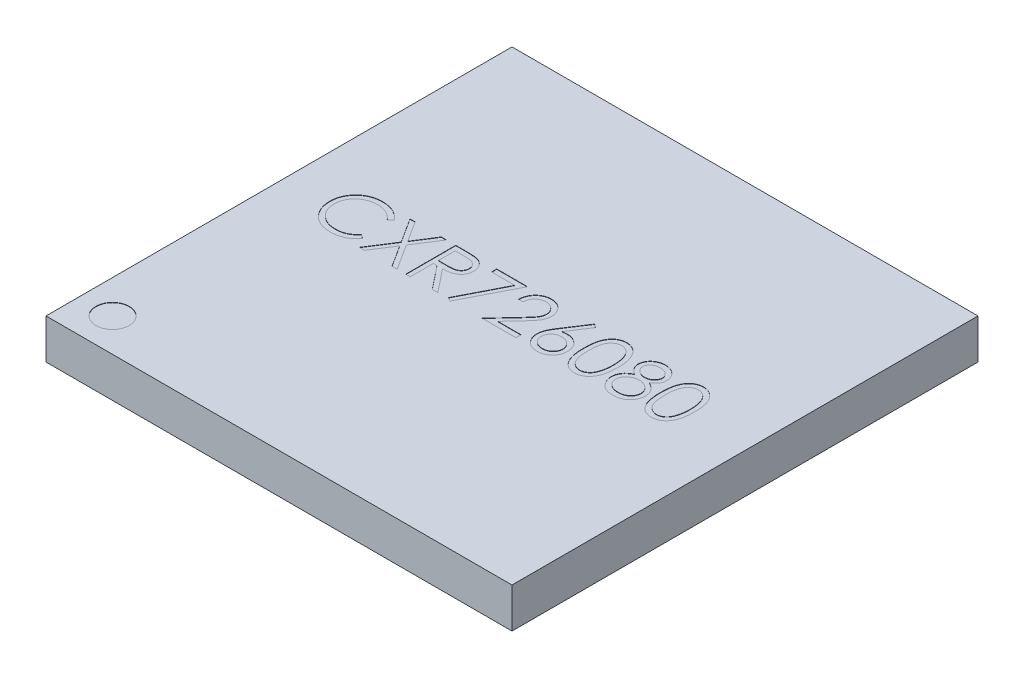
from build123d import *

# Parameters (mm, degrees)
SKIZZE1_W                         = 14
SKIZZE1_H                         = 14
AUFSATZ_LINEAR_AUSTRAGEN1_DEPTH   = 1.2
SKIZZE2_R                         = 0.5
SCHNITT_LINEAR_AUSTRAGEN1_DEPTH   = 0.01
SKIZZE3_R                         = 0.25
AUFSATZ_LINEAR_AUSTRAGEN2_DEPTH   = 0.35
VERRUNDUNG1_R                     = 0.25
LINEARES_MUSTER1_COUNT            = 13
LINEARES_MUSTER1_PITCH            = 1
LINEARES_MUSTER1_COUNT_DIR2       = 13
LINEARES_MUSTER1_PITCH_DIR2       = 1
VERRUNDUNG1_OF_LINEARES_MUSTER1_R = 0.25
SKIZZE4_W                         = 0.885473141
SKIZZE4_H                         = 0.819393056
SKIZZE4_W_2                       = 0.779745005
SKIZZE4_W_3                       = 0.753312971
SKIZZE4_H_2                       = 0.832609073
SKIZZE4_W_4                       = 0.925121192
SKIZZE4_H_3                       = 0.885473142
SCHNITT_LINEAR_AUSTRAGEN2_DEPTH   = 10.971960842


with BuildPart() as part:
    # Skizze1 → Aufsatz-Linear austragen1 (new body)
    with BuildSketch(Plane(origin=(0, 0, 0), x_dir=(1, 0, 0), z_dir=(0, 1, 0))):
        Rectangle(SKIZZE1_W, SKIZZE1_H)
    extrude(amount=AUFSATZ_LINEAR_AUSTRAGEN1_DEPTH)

    # Skizze2 → Schnitt-Linear austragen1 (cut)
    # profile 1 of 10: a face of its own
    with BuildSketch(Plane(origin=(0, 1.2, 0), x_dir=(1, 0, 0), z_dir=(0, 1, 0))):
        with Locations((-6, -6)):
            Circle(SKIZZE2_R)
    # profile 2 of 10: a face of its own
    with BuildSketch(Plane(origin=(0, 1.2, 0), x_dir=(1, 0, 0), z_dir=(0, 1, 0))):
        with BuildLine():
            Line((-4.259270045, 0.717264561), (-4.377058507, 0.627120331))
            add(Edge.make_bspline(
                [(-4.377058507, 0.627120331), (-4.38546103, 0.637134318), (-4.402152793, 0.657027281), (-4.429006737, 0.684961372), (-4.456993155, 0.711132198), (-4.48610135, 0.735664432), (-4.516855259, 0.757700189), (-4.548509887, 0.778387805), (-4.581594763, 0.796931121), (-4.627345506, 0.819415258), (-4.687194584, 0.842877896), (-4.76253523, 0.862550709), (-4.841182843, 0.87507407), (-4.894838957, 0.876430431), (-4.922130622, 0.877120331)],
                knots=[0, 0, 0, 0, 0.757959112, 1.505699292, 2.245454638, 2.979532153, 3.711538275, 4.438200793, 5.171680507, 5.909471876, 7.393775596, 8.890124382, 10.418191784, 12, 12, 12, 12], degree=3))
            add(Edge.make_bspline(
                [(-4.922130622, 0.877120331), (-4.937166322, 0.876947204), (-4.967098176, 0.876602557), (-5.01151895, 0.872055789), (-5.055110258, 0.86566527), (-5.097843743, 0.856182989), (-5.139665011, 0.844194724), (-5.180847469, 0.829869546), (-5.220794869, 0.812146044), (-5.260059828, 0.792556789), (-5.29767949, 0.770430742), (-5.333274511, 0.746296448), (-5.366715068, 0.720423978), (-5.398027616, 0.692716361), (-5.427244166, 0.663298378), (-5.454153013, 0.631856517), (-5.478661046, 0.5984913), (-5.501254057, 0.563642697), (-5.521488085, 0.527412215), (-5.538429462, 0.489665756), (-5.553431657, 0.451049712), (-5.565302761, 0.411127786), (-5.574698983, 0.370180886), (-5.581182267, 0.32809912), (-5.585677326, 0.2849704), (-5.586020259, 0.255737837), (-5.586193122, 0.241002542)],
                knots=[0, 0, 0, 0, 1.054917814, 2.100044995, 3.131103042, 4.146048494, 5.169673617, 6.183595914, 7.203665975, 8.234915748, 9.262203917, 10.264457458, 11.251630812, 12.227803204, 13.197192746, 14.159520551, 15.12972552, 16.100847026, 17.073214652, 18.039054194, 19.002613845, 19.979014051, 20.95965708, 21.949030935, 22.966165397, 24, 24, 24, 24], degree=3))
            add(Edge.make_bspline(
                [(-5.586193122, 0.241002542), (-5.585652342, 0.218831976), (-5.584590593, 0.175303011), (-5.575141307, 0.111544178), (-5.560781982, 0.05046389), (-5.539261021, -0.007556043), (-5.512724285, -0.063231053), (-5.479192594, -0.115619133), (-5.440356935, -0.165511947), (-5.395667899, -0.211730353), (-5.346636835, -0.253950521), (-5.294030587, -0.291129342), (-5.237980178, -0.322121434), (-5.179104479, -0.347911125), (-5.11695043, -0.367735437), (-5.051629801, -0.38169149), (-4.98328466, -0.390795282), (-4.936583488, -0.391666863), (-4.912815718, -0.392110439)],
                knots=[0, 0, 0, 0, 1.029171465, 2.020641659, 2.987623507, 3.938342917, 4.889210282, 5.84687017, 6.821220943, 7.821438502, 8.827599549, 9.822697543, 10.807740252, 11.797342354, 12.80366471, 13.83203677, 14.896651826, 16, 16, 16, 16], degree=3))
            add(Edge.make_bspline(
                [(-4.912815718, -0.392110439), (-4.886628851, -0.391386676), (-4.835086833, -0.389962138), (-4.759500536, -0.377893888), (-4.687142351, -0.358326209), (-4.618008385, -0.330941385), (-4.552293537, -0.295341976), (-4.489894968, -0.252185743), (-4.430760009, -0.201062172), (-4.395200888, -0.162026545), (-4.377058507, -0.142110439)],
                knots=[0, 0, 0, 0, 1.028121516, 2.023589091, 2.998037872, 3.967518031, 4.937445131, 5.927275754, 6.942489185, 8, 8, 8, 8], degree=3))
            Line((-4.377058507, -0.142110439), (-4.259270045, -0.231353227))
            add(Edge.make_bspline(
                [(-4.259270045, -0.231353227), (-4.268749235, -0.243583992), (-4.28766221, -0.267986938), (-4.318287074, -0.302389099), (-4.350548773, -0.334747971), (-4.384686935, -0.364802666), (-4.420308845, -0.39315458), (-4.458054122, -0.418998222), (-4.497426565, -0.442694315), (-4.53829277, -0.464391569), (-4.580609318, -0.483641817), (-4.624325505, -0.500122004), (-4.669252894, -0.514318385), (-4.715393541, -0.525997786), (-4.762843151, -0.535113965), (-4.811430497, -0.541208111), (-4.861260443, -0.545383218), (-4.894878195, -0.545763753), (-4.911914276, -0.545956593)],
                knots=[0, 0, 0, 0, 0.986787822, 1.968848986, 2.935600012, 3.899624008, 4.868462664, 5.837806735, 6.815139263, 7.798259679, 8.787526145, 9.778297419, 10.776456485, 11.791383307, 12.812564526, 13.85620153, 14.913611965, 16, 16, 16, 16], degree=3))
            add(Edge.make_bspline(
                [(-4.911914276, -0.545956593), (-4.928047276, -0.54584431), (-4.959948286, -0.545622285), (-5.007047751, -0.542025642), (-5.052900428, -0.537118612), (-5.097375268, -0.529729984), (-5.140714972, -0.521010981), (-5.182526651, -0.5093233), (-5.223221741, -0.4962308), (-5.262636744, -0.480842949), (-5.300805187, -0.46347887), (-5.337603963, -0.443853917), (-5.373016148, -0.422133117), (-5.4073899, -0.398795256), (-5.440217436, -0.373090698), (-5.471783233, -0.345376426), (-5.502264294, -0.31574585), (-5.521122587, -0.294379484), (-5.53060418, -0.283636881)],
                knots=[0, 0, 0, 0, 1.114604814, 2.203992996, 3.262667896, 4.300477797, 5.318619304, 6.316056647, 7.298880507, 8.271930387, 9.238335007, 10.195173496, 11.151986948, 12.108099108, 13.064862484, 14.031167946, 15.010108607, 16, 16, 16, 16], degree=3))
            add(Edge.make_bspline(
                [(-5.53060418, -0.283636881), (-5.545790884, -0.264976371), (-5.575980945, -0.227880638), (-5.614606238, -0.167758075), (-5.647669476, -0.104985986), (-5.674402014, -0.039234587), (-5.695300328, 0.029348578), (-5.709777983, 0.100798085), (-5.719185814, 0.175047203), (-5.720261652, 0.225548684), (-5.720808507, 0.251218888)],
                knots=[0, 0, 0, 0, 0.994628077, 1.977248131, 2.950237994, 3.925870899, 4.908910175, 5.911660606, 6.938484602, 8, 8, 8, 8], degree=3))
            add(Edge.make_bspline(
                [(-5.720808507, 0.251218888), (-5.720141995, 0.278199797), (-5.718830675, 0.33128305), (-5.70768962, 0.409186173), (-5.689767279, 0.483822487), (-5.664311469, 0.555052663), (-5.632037747, 0.623251355), (-5.592169199, 0.687897585), (-5.545168995, 0.749404785), (-5.491405751, 0.806839679), (-5.432448322, 0.859356544), (-5.369311688, 0.905559203), (-5.302119425, 0.944009567), (-5.231611774, 0.976150779), (-5.157260767, 1.000855549), (-5.079225038, 1.018149772), (-4.997651217, 1.02891425), (-4.941995892, 1.030275054), (-4.91371716, 1.030966484)],
                knots=[0, 0, 0, 0, 1.032925535, 2.032216505, 3.007276963, 3.968222605, 4.92396291, 5.891752235, 6.871517503, 7.883894988, 8.900124299, 9.891468569, 10.874487609, 11.85992873, 12.854644235, 13.869047385, 14.917252991, 16, 16, 16, 16], degree=3))
            add(Edge.make_bspline(
                [(-4.91371716, 1.030966484), (-4.896482387, 1.030759854), (-4.862367888, 1.030350849), (-4.811902465, 1.026362503), (-4.76277004, 1.019713814), (-4.714936762, 1.01066407), (-4.668169926, 0.999432361), (-4.622826966, 0.984800804), (-4.578641814, 0.968070862), (-4.535893139, 0.948802948), (-4.494786046, 0.927174345), (-4.455333338, 0.903424792), (-4.417848399, 0.877583732), (-4.382067464, 0.849870943), (-4.348589088, 0.819700132), (-4.31646274, 0.787901162), (-4.286779421, 0.753558095), (-4.268456623, 0.729384552), (-4.259270045, 0.717264561)],
                knots=[0, 0, 0, 0, 1.096760587, 2.17092713, 3.219439832, 4.250915756, 5.268269357, 6.278326846, 7.281116186, 8.274029601, 9.260640565, 10.235837813, 11.203064059, 12.156899882, 13.114053108, 14.069676657, 15.032185724, 16, 16, 16, 16], degree=3))
        make_face()
    # profile 3 of 10: a face of its own
    with BuildSketch(Plane(origin=(0, 1.2, 0), x_dir=(1, 0, 0), z_dir=(0, 1, 0))):
        Polygon((-4.057346968, 0.992504946), (-3.90199841, 0.992504946), (-3.509270045, 0.378923215), (-3.11654168, 0.992504946), (-2.961193122, 0.992504946), (-3.431445526, 0.257528984), (-2.941962353, -0.507495054), (-3.09731091, -0.507495054), (-3.509270045, 0.136134754), (-3.92122918, -0.507495054), (-4.076577737, -0.507495054), (-3.586794083, 0.257528984), align=None)
    # profile 4 of 10: a face of its own
    with BuildSketch(Plane(origin=(0, 1.2, 0), x_dir=(1, 0, 0), z_dir=(0, 1, 0))):
        with BuildLine():
            Line((-2.682346968, 0.992504946), (-2.38216668, 0.992504946))
            add(Edge.make_bspline(
                [(-2.38216668, 0.992504946), (-2.362134767, 0.992438266), (-2.323671277, 0.992310234), (-2.268568447, 0.991596335), (-2.218499691, 0.989550183), (-2.173491188, 0.987789361), (-2.133543765, 0.984578529), (-2.098534926, 0.981509681), (-2.068625913, 0.977492398), (-2.050520548, 0.973761502), (-2.04232293, 0.972072254)],
                knots=[0, 0, 0, 0, 1.410062039, 2.707475311, 3.878576406, 4.937260626, 5.877586885, 6.699081471, 7.410979367, 8, 8, 8, 8], degree=3))
            add(Edge.make_bspline(
                [(-2.04232293, 0.972072254), (-2.031348662, 0.969360783), (-2.009634238, 0.963995684), (-1.978369924, 0.952655855), (-1.948578071, 0.939533159), (-1.920382432, 0.924120136), (-1.893924236, 0.906302373), (-1.868930674, 0.886387464), (-1.845288332, 0.864484375), (-1.823953348, 0.840040872), (-1.803836612, 0.814396653), (-1.786870057, 0.786666472), (-1.772244423, 0.757668674), (-1.760599916, 0.727108352), (-1.751223642, 0.695281879), (-1.744612396, 0.661900966), (-1.740647602, 0.627117691), (-1.740243949, 0.603392873), (-1.740039276, 0.591363119)],
                knots=[0, 0, 0, 0, 1.027469482, 2.033020251, 3.019912614, 3.986113645, 4.951240523, 5.91722682, 6.890402269, 7.87763091, 8.8651537, 9.85103654, 10.82876324, 11.815024772, 12.821070561, 13.842952187, 14.906261191, 16, 16, 16, 16], degree=3))
            add(Edge.make_bspline(
                [(-1.740039276, 0.591363119), (-1.740668846, 0.571376646), (-1.741897302, 0.532377859), (-1.753350918, 0.475780339), (-1.772112283, 0.422984918), (-1.797965121, 0.374058073), (-1.830887754, 0.329953511), (-1.870455521, 0.291214745), (-1.916690498, 0.258797639), (-1.959731633, 0.236317866), (-1.997752004, 0.221920905), (-2.029051996, 0.211791037), (-2.063194986, 0.20396448), (-2.099853844, 0.196952995), (-2.139181125, 0.191659412), (-2.18108257, 0.1877823), (-2.225588064, 0.185359136), (-2.25616195, 0.184998277), (-2.271890237, 0.184812638)],
                knots=[0, 0, 0, 0, 1.260483769, 2.459530307, 3.627416485, 4.787058657, 5.939039949, 7.08810263, 8.267026773, 9.491475466, 10.141966685, 10.831826277, 11.566392101, 12.351337768, 13.187381173, 14.07005841, 15.007169909, 16, 16, 16, 16], degree=3))
            Line((-2.271890237, 0.184812638), (-1.720808507, -0.507495054))
            Line((-1.720808507, -0.507495054), (-1.887274853, -0.507495054))
            Line((-1.887274853, -0.507495054), (-2.438356583, 0.184812638))
            Line((-2.438356583, 0.184812638), (-2.547731583, 0.184812638))
            Line((-2.547731583, 0.184812638), (-2.547731583, -0.507495054))
            Line((-2.547731583, -0.507495054), (-2.682346968, -0.507495054))
            Line((-2.682346968, -0.507495054), (-2.682346968, 0.992504946))
        make_face()
        with BuildLine():
            Line((-2.547731583, 0.838658792), (-2.547731583, 0.338658792))
            Line((-2.547731583, 0.338658792), (-2.27309216, 0.336555427))
            add(Edge.make_bspline(
                [(-2.27309216, 0.336555427), (-2.260269287, 0.336549754), (-2.235414905, 0.336538758), (-2.199457477, 0.338250377), (-2.165977429, 0.340197513), (-2.135102821, 0.343175804), (-2.10681986, 0.34701412), (-2.081142683, 0.351815399), (-2.058029375, 0.357409141), (-2.031072859, 0.36606698), (-2.000971488, 0.379783845), (-1.968258005, 0.399740487), (-1.940399861, 0.424841538), (-1.916863634, 0.453544448), (-1.897951021, 0.485102841), (-1.884617283, 0.519138427), (-1.876156236, 0.554791969), (-1.875158288, 0.579296873), (-1.87465466, 0.5916636)],
                knots=[0, 0, 0, 0, 1.146690395, 2.22261258, 3.21895312, 4.145990853, 4.996080663, 5.770904154, 6.481378293, 7.121626537, 8.300444488, 9.431385265, 10.535395872, 11.636531494, 12.74115979, 13.810798291, 14.895190096, 16, 16, 16, 16], degree=3))
            add(Edge.make_bspline(
                [(-1.87465466, 0.5916636), (-1.875169855, 0.603726417), (-1.876190783, 0.627630519), (-1.88452597, 0.662625909), (-1.898621419, 0.695654602), (-1.917616664, 0.726582239), (-1.940759159, 0.754656126), (-1.967895364, 0.778676334), (-1.998283305, 0.798497533), (-2.026685247, 0.811163696), (-2.052071338, 0.818929348), (-2.074112621, 0.824394132), (-2.09901754, 0.828784619), (-2.126907022, 0.832302359), (-2.157662007, 0.835325907), (-2.191438, 0.837362383), (-2.228010906, 0.838568325), (-2.253359591, 0.838627935), (-2.266481583, 0.838658792)],
                knots=[0, 0, 0, 0, 1.101028733, 2.181837193, 3.264309656, 4.369019818, 5.486613113, 6.575447106, 7.666700264, 8.788928104, 9.402425223, 10.0903467, 10.862060571, 11.710948788, 12.657782767, 13.684531032, 14.801375019, 16, 16, 16, 16], degree=3))
            Line((-2.266481583, 0.838658792), (-2.547731583, 0.838658792))
        make_face(mode=Mode.SUBTRACT)
    # profile 5 of 10: a face of its own
    with BuildSketch(Plane(origin=(0, 1.2, 0), x_dir=(1, 0, 0), z_dir=(0, 1, 0))):
        Polygon((-1.451577737, 0.992504946), (-0.528500814, 0.992504946), (-1.316962353, -0.545956593), (-1.43324841, -0.481954189), (-0.756265237, 0.838658792), (-1.451577737, 0.838658792), align=None)
    # profile 6 of 10: a face of its own
    with BuildSketch(Plane(origin=(0, 1.2, 0), x_dir=(1, 0, 0), z_dir=(0, 1, 0))):
        with BuildLine():
            Line((-0.201577737, 0.530966484), (-0.336193122, 0.530966484))
            add(Edge.make_bspline(
                [(-0.336193122, 0.530966484), (-0.335315771, 0.548825436), (-0.333592676, 0.583899943), (-0.325523409, 0.63503876), (-0.313977319, 0.683919388), (-0.29765241, 0.730149351), (-0.277378291, 0.774137411), (-0.253065422, 0.815708846), (-0.224268058, 0.85470507), (-0.191608029, 0.890764574), (-0.156135755, 0.923844962), (-0.117861781, 0.952411494), (-0.077642483, 0.976547639), (-0.035599884, 0.996725314), (0.008740358, 1.011870963), (0.054975868, 1.023108808), (0.103309784, 1.029870099), (0.136241222, 1.030596864), (0.15298957, 1.030966484)],
                knots=[0, 0, 0, 0, 1.10065271, 2.161652631, 3.183658789, 4.190468796, 5.17591951, 6.163126047, 7.15150782, 8.156236427, 9.156009102, 10.134482811, 11.092018607, 12.041330605, 13.001268258, 13.972401359, 14.968799086, 16, 16, 16, 16], degree=3))
            add(Edge.make_bspline(
                [(0.15298957, 1.030966484), (0.169437316, 1.030581432), (0.20175655, 1.029824817), (0.248925985, 1.023327233), (0.293830539, 1.013150551), (0.336382439, 0.998872515), (0.376242181, 0.979679189), (0.4137092, 0.956623101), (0.449229548, 0.929957459), (0.481203884, 0.898562968), (0.510564489, 0.86504766), (0.535894027, 0.82926713), (0.557585383, 0.792311722), (0.575665817, 0.753899635), (0.588975591, 0.713669194), (0.599080537, 0.672206108), (0.604792286, 0.629081189), (0.605668896, 0.599892665), (0.60611457, 0.585053023)],
                knots=[0, 0, 0, 0, 1.111607364, 2.184268762, 3.212621178, 4.221274766, 5.211760367, 6.196651075, 7.1921475, 8.207485113, 9.220403448, 10.201281604, 11.166441695, 12.114753415, 13.065576456, 14.026450734, 14.996634279, 16, 16, 16, 16], degree=3))
            add(Edge.make_bspline(
                [(0.60611457, 0.585053023), (0.605388886, 0.564161094), (0.603950253, 0.522743859), (0.591644092, 0.461880347), (0.572424158, 0.402911739), (0.549282434, 0.355452895), (0.525937101, 0.317209969), (0.504899597, 0.285723381), (0.480271821, 0.251821037), (0.451695322, 0.215616464), (0.419761234, 0.176826076), (0.384180307, 0.135473307), (0.344698815, 0.091985406), (0.316988029, 0.062283005), (0.302628993, 0.046891965)],
                knots=[0, 0, 0, 0, 1.184426356, 2.348067706, 3.509069118, 4.696110526, 5.333549288, 6.050745305, 6.844228056, 7.710549037, 8.667450064, 9.695053472, 10.805634456, 12, 12, 12, 12], degree=3))
            Line((0.302628993, 0.046891965), (-0.072671487, -0.3536489))
            Line((-0.072671487, -0.3536489), (0.62534534, -0.3536489))
            Line((0.62534534, -0.3536489), (0.62534534, -0.507495054))
            Line((0.62534534, -0.507495054), (-0.39388543, -0.507495054))
            Line((-0.39388543, -0.507495054), (0.18784534, 0.113298215))
            add(Edge.make_bspline(
                [(0.18784534, 0.113298215), (0.20200872, 0.128083204), (0.229213674, 0.156482141), (0.267691921, 0.197943409), (0.302251488, 0.236407498), (0.333116085, 0.271801733), (0.359616158, 0.304643834), (0.383132829, 0.333870135), (0.401975225, 0.3607649), (0.422424681, 0.391939449), (0.442230673, 0.43000187), (0.459250254, 0.476516309), (0.469628046, 0.524399417), (0.470872976, 0.556757433), (0.471499186, 0.573033792)],
                knots=[0, 0, 0, 0, 1.329631726, 2.553950428, 3.673215718, 4.687767853, 5.603093632, 6.413772471, 7.123043292, 7.734684054, 8.834405432, 9.900288307, 10.943827018, 12, 12, 12, 12], degree=3))
            add(Edge.make_bspline(
                [(0.471499186, 0.573033792), (0.471226725, 0.583268677), (0.470689757, 0.60343967), (0.465950743, 0.633013567), (0.458789098, 0.661541344), (0.448526844, 0.689110752), (0.434981099, 0.715444603), (0.418492507, 0.740574952), (0.399468194, 0.764870223), (0.377460507, 0.787650208), (0.353284142, 0.808513581), (0.327743749, 0.826995332), (0.300722276, 0.842440665), (0.272333652, 0.855102164), (0.242657022, 0.865034471), (0.211634989, 0.871916719), (0.179353268, 0.876237783), (0.157310341, 0.876822428), (0.146078513, 0.877120331)],
                knots=[0, 0, 0, 0, 0.991446411, 1.95395049, 2.89581595, 3.838931463, 4.798493298, 5.75982156, 6.748411868, 7.785213223, 8.824556874, 9.840280684, 10.836137867, 11.835679398, 12.848801643, 13.863922112, 14.911575587, 16, 16, 16, 16], degree=3))
            add(Edge.make_bspline(
                [(0.146078513, 0.877120331), (0.134348156, 0.876813888), (0.111311672, 0.876212086), (0.077489229, 0.872002373), (0.045223896, 0.86473987), (0.014434509, 0.854807009), (-0.014931028, 0.842181917), (-0.042729904, 0.826456883), (-0.068899714, 0.807692529), (-0.093489652, 0.786418005), (-0.116145643, 0.76273189), (-0.136051447, 0.73632762), (-0.153444596, 0.7076873), (-0.168619982, 0.676888206), (-0.180943849, 0.643650872), (-0.190360914, 0.608093284), (-0.197812419, 0.570369835), (-0.200301785, 0.544319085), (-0.201577737, 0.530966484)],
                knots=[0, 0, 0, 0, 1.031018746, 2.02475058, 2.990194455, 3.934040569, 4.864654155, 5.795059489, 6.735614925, 7.690564532, 8.649604399, 9.611025574, 10.590972636, 11.591080095, 12.624614302, 13.701020113, 14.821632451, 16, 16, 16, 16], degree=3))
        make_face()
    # profile 7 of 10: a face of its own
    with BuildSketch(Plane(origin=(0, 1.2, 0), x_dir=(1, 0, 0), z_dir=(0, 1, 0))):
        with BuildLine():
            Line((1.452268417, 1.030966484), (1.555934282, 0.949536196))
            Line((1.555934282, 0.949536196), (1.159600147, 0.343466484))
            add(Edge.make_bspline(
                [(1.159600147, 0.343466484), (1.185987409, 0.347672425), (1.237458746, 0.355876587), (1.289558417, 0.357229992), (1.314948705, 0.357889561)],
                knots=[0, 0, 0, 0, 1.025318673, 2, 2, 2, 2], degree=3))
            add(Edge.make_bspline(
                [(1.314948705, 0.357889561), (1.330194061, 0.357479799), (1.360204089, 0.356673195), (1.404264147, 0.35046583), (1.446602263, 0.340683639), (1.487042954, 0.326424101), (1.525731375, 0.308208806), (1.562889544, 0.286377862), (1.597818977, 0.259803999), (1.630969483, 0.230119018), (1.66106681, 0.19724031), (1.687713691, 0.162354023), (1.710096602, 0.125496502), (1.728256854, 0.086686417), (1.742358945, 0.045983592), (1.752639364, 0.003440103), (1.758716332, -0.040973385), (1.759541543, -0.071178317), (1.759960724, -0.086521496)],
                knots=[0, 0, 0, 0, 1.04369286, 2.054478336, 3.041073146, 4.015093852, 4.984733326, 5.965804835, 6.960378782, 7.985147595, 9.009457201, 10.008161701, 10.986880575, 11.956520048, 12.937015923, 13.931873656, 14.949455224, 16, 16, 16, 16], degree=3))
            add(Edge.make_bspline(
                [(1.759960724, -0.086521496), (1.759350822, -0.107512798), (1.758150679, -0.148818712), (1.746191909, -0.208980158), (1.727609205, -0.266294093), (1.701047407, -0.319845452), (1.668054957, -0.369560839), (1.627821703, -0.413611753), (1.581774494, -0.452898912), (1.529708723, -0.485751748), (1.473676024, -0.512581627), (1.414810882, -0.531852445), (1.353684962, -0.543716789), (1.312197273, -0.545204191), (1.291210724, -0.545956593)],
                knots=[0, 0, 0, 0, 1.031375318, 2.029502543, 3.004789286, 3.987476834, 4.960371455, 5.9300674, 6.912260825, 7.929083631, 8.949397511, 9.960523116, 10.96833055, 12, 12, 12, 12], degree=3))
            add(Edge.make_bspline(
                [(1.291210724, -0.545956593), (1.271026424, -0.545301647), (1.231044859, -0.544004315), (1.172230804, -0.532447485), (1.115718083, -0.513715869), (1.061902634, -0.48790975), (1.012050943, -0.455313514), (0.967451384, -0.416072538), (0.928326338, -0.371025624), (0.895765786, -0.320179761), (0.869940615, -0.265541208), (0.850573504, -0.208568141), (0.839260829, -0.149468148), (0.837680019, -0.109404803), (0.836883801, -0.089225823)],
                knots=[0, 0, 0, 0, 1.012016664, 2.004627821, 2.994792927, 3.992885782, 4.990978636, 5.973936114, 6.964471063, 7.975201453, 8.993600317, 9.990122807, 10.98767138, 12, 12, 12, 12], degree=3))
            add(Edge.make_bspline(
                [(0.836883801, -0.089225823), (0.837390135, -0.073778145), (0.838423971, -0.042236937), (0.845642567, 0.005533361), (0.857241765, 0.054412396), (0.87023187, 0.095878479), (0.883957132, 0.129847703), (0.895379649, 0.157234913), (0.909597076, 0.18541823), (0.924757096, 0.215364074), (0.942224326, 0.246300688), (0.961216747, 0.278745118), (0.982259454, 0.312181372), (0.997010953, 0.334871742), (1.00455207, 0.346471292)],
                knots=[0, 0, 0, 0, 1.173818275, 2.396712641, 3.66331629, 4.989737886, 5.693666774, 6.447286557, 7.243889047, 8.091586357, 8.998013824, 9.943181721, 10.948533338, 12, 12, 12, 12], degree=3))
            Line((1.00455207, 0.346471292), (1.452268417, 1.030966484))
        make_face()
        with BuildLine():
            add(Edge.make_bspline(
                [(1.286703513, 0.204043407), (1.275276836, 0.20370996), (1.252957218, 0.203058641), (1.220211183, 0.19927639), (1.18921979, 0.192153933), (1.159572447, 0.183082648), (1.131823431, 0.170609908), (1.105771071, 0.155459137), (1.08131462, 0.137621489), (1.058710241, 0.11734967), (1.0382161, 0.095154799), (1.020567044, 0.071382147), (1.005343158, 0.046604631), (0.992965235, 0.020615227), (0.983326632, -0.00657613), (0.976354524, -0.034844379), (0.972474345, -0.064379082), (0.971828817, -0.084407297), (0.971499186, -0.094634477)],
                knots=[0, 0, 0, 0, 1.129588631, 2.206414736, 3.251139165, 4.268635594, 5.265702196, 6.250456724, 7.242448911, 8.251968645, 9.246821453, 10.222880186, 11.173611482, 12.116736599, 13.062300278, 14.020270554, 14.989073742, 16, 16, 16, 16], degree=3))
            add(Edge.make_bspline(
                [(0.971499186, -0.094634477), (0.971767626, -0.104770183), (0.972293999, -0.124644793), (0.977073564, -0.153933013), (0.984374314, -0.182117973), (0.995234483, -0.209054373), (1.008188864, -0.235152795), (1.025291146, -0.259467917), (1.044241197, -0.283476519), (1.066892883, -0.305334292), (1.091202895, -0.325672845), (1.117174839, -0.343450097), (1.144243394, -0.358658457), (1.172774003, -0.370577499), (1.202361882, -0.380359336), (1.233253548, -0.387242827), (1.265470486, -0.391134481), (1.287294174, -0.39178085), (1.298422263, -0.392110439)],
                knots=[0, 0, 0, 0, 0.989467248, 1.94019797, 2.891935182, 3.827694429, 4.772920941, 5.730924762, 6.725747692, 7.756678648, 8.79901574, 9.819492441, 10.826891316, 11.826466727, 12.835195252, 13.867842842, 14.912794438, 16, 16, 16, 16], degree=3))
            add(Edge.make_bspline(
                [(1.298422263, -0.392110439), (1.309550334, -0.391780824), (1.331373985, -0.391134404), (1.363591183, -0.387243118), (1.394481891, -0.380358269), (1.424073252, -0.370581367), (1.452591008, -0.358644106), (1.479635888, -0.343544712), (1.505362214, -0.325563518), (1.529688185, -0.305369049), (1.552245588, -0.283352113), (1.571650136, -0.259682232), (1.588228664, -0.234956276), (1.601700459, -0.209157181), (1.612441012, -0.182101686), (1.619778784, -0.153937376), (1.624548479, -0.12464365), (1.625076207, -0.104769797), (1.62534534, -0.094634477)],
                knots=[0, 0, 0, 0, 1.087397944, 2.132534446, 3.165364764, 4.174271784, 5.174024072, 6.181601208, 7.194203697, 8.236725232, 9.267838612, 10.269026844, 11.221737037, 12.171628256, 13.107553087, 14.05945871, 15.010357665, 16, 16, 16, 16], degree=3))
            add(Edge.make_bspline(
                [(1.62534534, -0.094634477), (1.6251095, -0.084393955), (1.624646623, -0.064295141), (1.619411216, -0.034857591), (1.612150199, -0.006432502), (1.601186043, 0.020801476), (1.586941809, 0.046736873), (1.569591778, 0.071504702), (1.549520676, 0.095294851), (1.526336016, 0.117393197), (1.501097345, 0.137599088), (1.474262094, 0.155436041), (1.446187248, 0.170489602), (1.416901273, 0.183049789), (1.386068609, 0.192113849), (1.354187035, 0.199250953), (1.320848788, 0.203048961), (1.298230242, 0.203707703), (1.286703513, 0.204043407)],
                knots=[0, 0, 0, 0, 0.978206639, 1.919901502, 2.851605144, 3.780102724, 4.718870031, 5.675451981, 6.667674623, 7.690630536, 8.733308323, 9.756129687, 10.767539656, 11.776269907, 12.797430371, 13.836405707, 14.897401972, 16, 16, 16, 16], degree=3))
        make_face(mode=Mode.SUBTRACT)
    # profile 8 of 10: a face of its own
    with BuildSketch(Plane(origin=(0, 1.2, 0), x_dir=(1, 0, 0), z_dir=(0, 1, 0))):
        with BuildLine():
            add(Edge.make_bspline(
                [(1.913806878, 0.241903984), (1.913947457, 0.265945722), (1.914220534, 0.312647144), (1.917258429, 0.380697705), (1.922305004, 0.444537829), (1.929221021, 0.504170571), (1.937637299, 0.559611327), (1.948872507, 0.610711938), (1.961649423, 0.657708912), (1.976457614, 0.700755504), (1.993166666, 0.740431662), (2.011352778, 0.777471034), (2.03173769, 0.811817577), (2.053156367, 0.844019487), (2.076475826, 0.873549642), (2.10103245, 0.900825069), (2.127784683, 0.92521539), (2.155823115, 0.947435234), (2.1854016, 0.966913579), (2.215677028, 0.984070467), (2.246857788, 0.998727553), (2.279029009, 1.010252026), (2.311901534, 1.01977096), (2.345590277, 1.026280509), (2.380150861, 1.030376327), (2.403478619, 1.030767899), (2.415309282, 1.030966484)],
                knots=[0, 0, 0, 0, 1.646270934, 3.197905019, 4.663502075, 6.030701355, 7.308322542, 8.50163776, 9.611534131, 10.641858119, 11.616356847, 12.558055219, 13.465016945, 14.349605745, 15.204443733, 16.039544428, 16.859896111, 17.680448484, 18.487036065, 19.28249412, 20.06191084, 20.843045899, 21.620316918, 22.403196591, 23.190181807, 24, 24, 24, 24], degree=3))
            add(Edge.make_bspline(
                [(2.415309282, 1.030966484), (2.427238773, 1.030757421), (2.450962777, 1.030341659), (2.486037223, 1.026345684), (2.520301372, 1.019715202), (2.553609146, 1.010320499), (2.58623414, 0.998665209), (2.617921172, 0.984056444), (2.648867064, 0.967051215), (2.678580045, 0.947069554), (2.707386308, 0.924791435), (2.734578293, 0.899607435), (2.760158472, 0.871771841), (2.784447889, 0.84158247), (2.80675743, 0.808460291), (2.828003187, 0.772981387), (2.847019774, 0.734525302), (2.865334635, 0.693733673), (2.881143343, 0.649477819), (2.895400306, 0.602007207), (2.906919864, 0.550761127), (2.916515266, 0.496008451), (2.923948793, 0.437548101), (2.929362782, 0.375505394), (2.932222676, 0.309839513), (2.932761262, 0.264943291), (2.933037647, 0.241903984)],
                knots=[0, 0, 0, 0, 0.810914788, 1.612654377, 2.396697861, 3.181598691, 3.963628158, 4.749916497, 5.551656086, 6.361998678, 7.18212741, 8.025565596, 8.878627764, 9.750805457, 10.657531673, 11.591944965, 12.560506719, 13.57287815, 14.630710178, 15.753379473, 16.941251878, 18.199788006, 19.531962791, 20.947069417, 22.433333509, 24, 24, 24, 24], degree=3))
            add(Edge.make_bspline(
                [(2.933037647, 0.241903984), (2.932758397, 0.218965167), (2.932214289, 0.174269816), (2.929394843, 0.108899398), (2.923841144, 0.047185951), (2.916894006, -0.011018533), (2.907272165, -0.065471798), (2.895441379, -0.116362276), (2.882305526, -0.163909736), (2.866090615, -0.207724655), (2.848343167, -0.24841825), (2.829033798, -0.286418457), (2.808346729, -0.322061154), (2.785808696, -0.355061045), (2.761785804, -0.385651898), (2.735763895, -0.413293736), (2.708476501, -0.438652596), (2.679585466, -0.461217579), (2.649409087, -0.48096821), (2.618569482, -0.498631288), (2.586519461, -0.512873872), (2.553985338, -0.525103175), (2.520501753, -0.534446226), (2.486110443, -0.54090645), (2.450986341, -0.545437242), (2.427242814, -0.545782876), (2.415309282, -0.545956593)],
                knots=[0, 0, 0, 0, 1.561518951, 3.042555995, 4.452378317, 5.7783523, 7.031515105, 8.214008947, 9.334062868, 10.386615937, 11.391082383, 12.354592575, 13.286541444, 14.194233754, 15.072674879, 15.931287219, 16.775624067, 17.606195743, 18.42308326, 19.229000347, 20.022332153, 20.807536673, 21.593273796, 22.3848459, 23.188221202, 24, 24, 24, 24], degree=3))
            add(Edge.make_bspline(
                [(2.415309282, -0.545956593), (2.403478947, -0.545756726), (2.380151837, -0.545362628), (2.345586512, -0.541285314), (2.312036893, -0.534730099), (2.279337427, -0.525551554), (2.247320349, -0.514316624), (2.21642194, -0.499679331), (2.186298647, -0.482821873), (2.157030838, -0.463623835), (2.129168483, -0.441628828), (2.102554795, -0.417301276), (2.077858358, -0.3900341), (2.054872317, -0.360257847), (2.033026279, -0.328246458), (2.012930834, -0.293562869), (1.994343325, -0.256344607), (1.977353257, -0.216351217), (1.962289545, -0.172999105), (1.948983384, -0.125792314), (1.938477316, -0.074314185), (1.929484621, -0.01897817), (1.922231314, 0.040453514), (1.917279461, 0.104013133), (1.914218897, 0.17166108), (1.913946724, 0.218062412), (1.913806878, 0.241903984)],
                knots=[0, 0, 0, 0, 0.810891512, 1.598919785, 2.382837074, 3.152667961, 3.926044502, 4.706494248, 5.493654104, 6.291793342, 7.103789334, 7.925228297, 8.761435821, 9.622817696, 10.50288917, 11.416980706, 12.369136599, 13.353924996, 14.394355917, 15.514179734, 16.714354668, 17.994756427, 19.357759367, 20.818452758, 22.365282078, 24, 24, 24, 24], degree=3))
        make_face()
        with BuildLine():
            add(Edge.make_bspline(
                [(2.048422263, 0.242504946), (2.048473454, 0.222469789), (2.048572807, 0.183585484), (2.051168322, 0.12708123), (2.054704135, 0.07437966), (2.059264691, 0.025413859), (2.066037384, -0.019650432), (2.073626007, -0.061123154), (2.082860902, -0.098784827), (2.093787339, -0.132893888), (2.106232666, -0.164029203), (2.119820893, -0.193001153), (2.134418346, -0.220151983), (2.150755125, -0.245237815), (2.168547295, -0.268340457), (2.187392977, -0.289868813), (2.207995513, -0.30906752), (2.236497117, -0.332093315), (2.274124178, -0.355887229), (2.321532944, -0.376606982), (2.370247995, -0.389628035), (2.403312816, -0.39128393), (2.419816493, -0.392110439)],
                knots=[0, 0, 0, 0, 1.459021318, 2.831673884, 4.118529203, 5.306027144, 6.411944654, 7.436330062, 8.375795394, 9.233974572, 10.042671642, 10.816086306, 11.563610507, 12.285937304, 12.993564865, 13.685989202, 14.367179055, 15.041617293, 16.353048772, 17.594441528, 18.799311195, 20, 20, 20, 20], degree=3))
            add(Edge.make_bspline(
                [(2.419816493, -0.392110439), (2.436426924, -0.391425675), (2.469613491, -0.390057563), (2.518099403, -0.376858104), (2.565169519, -0.356942587), (2.602057494, -0.333393656), (2.630121441, -0.310967229), (2.650228722, -0.291846666), (2.668683886, -0.270437008), (2.686187632, -0.24733731), (2.702241522, -0.222106245), (2.716840009, -0.194865142), (2.730161444, -0.165538351), (2.737751035, -0.145065606), (2.741631397, -0.134598419)],
                knots=[0, 0, 0, 0, 1.353760809, 2.704726607, 4.075137775, 5.516104923, 6.260822281, 7.007110065, 7.778089737, 8.566572457, 9.372053459, 10.217411131, 11.088608312, 12, 12, 12, 12], degree=3))
            add(Edge.make_bspline(
                [(2.741631397, -0.134598419), (2.746153584, -0.121214245), (2.755335561, -0.094038632), (2.767169178, -0.051882781), (2.776488635, -0.007653025), (2.784872935, 0.03838631), (2.790595673, 0.086574754), (2.795201879, 0.136763204), (2.79791503, 0.188989502), (2.798251352, 0.22447307), (2.798422263, 0.242504946)],
                knots=[0, 0, 0, 0, 0.884706709, 1.796334032, 2.740027952, 3.714592787, 4.726048262, 5.777819803, 6.87074269, 8, 8, 8, 8], degree=3))
            add(Edge.make_bspline(
                [(2.798422263, 0.242504946), (2.798186467, 0.260533906), (2.797725201, 0.295802405), (2.795962064, 0.347453054), (2.791409103, 0.396510665), (2.786352338, 0.443186582), (2.778896386, 0.487222426), (2.770857326, 0.528986843), (2.760056806, 0.567962425), (2.74851976, 0.604759389), (2.735315305, 0.638959669), (2.72077999, 0.67072272), (2.705256379, 0.700201888), (2.688395419, 0.727316292), (2.670397269, 0.752187381), (2.650786891, 0.774316493), (2.63034216, 0.79438948), (2.601706223, 0.817302009), (2.564217241, 0.840664165), (2.517569107, 0.862163776), (2.469024545, 0.874510187), (2.43620735, 0.87625091), (2.419816493, 0.877120331)],
                knots=[0, 0, 0, 0, 1.31362396, 2.569729283, 3.763502607, 4.902122613, 5.988968491, 7.01645872, 7.998833611, 8.933434873, 9.825090667, 10.667526885, 11.477055099, 12.250526234, 12.991942729, 13.710640831, 14.402115721, 15.076753259, 16.378508321, 17.609869233, 18.806226677, 20, 20, 20, 20], degree=3))
            add(Edge.make_bspline(
                [(2.419816493, 0.877120331), (2.40322624, 0.876249711), (2.370015509, 0.874506885), (2.320966385, 0.862209776), (2.273950235, 0.840775648), (2.236560388, 0.817224631), (2.20790448, 0.794793926), (2.187726183, 0.775342588), (2.168806395, 0.754065622), (2.15137738, 0.730750516), (2.135053402, 0.70569393), (2.120061539, 0.678698745), (2.106554112, 0.64962816), (2.094089311, 0.618506831), (2.083129545, 0.584400712), (2.074089275, 0.546785429), (2.06573768, 0.505444618), (2.059825422, 0.460136258), (2.054569527, 0.411158192), (2.051191807, 0.358325055), (2.048564125, 0.301726035), (2.048470497, 0.262640682), (2.048422263, 0.242504946)],
                knots=[0, 0, 0, 0, 1.207732386, 2.417664972, 3.655092373, 4.956220595, 5.625982001, 6.301752483, 6.994047911, 7.697131622, 8.419323945, 9.170223765, 9.943494443, 10.752040957, 11.610060368, 12.549350801, 13.567764191, 14.679664412, 15.874934091, 17.154273443, 18.533957287, 20, 20, 20, 20], degree=3))
        make_face(mode=Mode.SUBTRACT)
    # profile 9 of 10: a face of its own
    with BuildSketch(Plane(origin=(0, 1.2, 0), x_dir=(1, 0, 0), z_dir=(0, 1, 0))):
        with BuildLine():
            add(Edge.make_bspline(
                [(3.796919859, 0.328141965), (3.809197808, 0.321739984), (3.833143908, 0.309253983), (3.867248426, 0.289149342), (3.898416284, 0.267960357), (3.927512239, 0.246687846), (3.954025103, 0.224517138), (3.977658423, 0.201360072), (3.998995975, 0.177794666), (4.017607453, 0.153421878), (4.033977526, 0.128306457), (4.048125584, 0.102382483), (4.060218671, 0.075706768), (4.069802788, 0.047988127), (4.077697841, 0.019633729), (4.083130243, -0.009722549), (4.08605178, -0.039887267), (4.086604128, -0.060273682), (4.086883801, -0.070596016)],
                knots=[0, 0, 0, 0, 1.272397273, 2.481599622, 3.635517121, 4.734568067, 5.792894095, 6.808321871, 7.773003508, 8.711915296, 9.623354172, 10.525449501, 11.423591555, 12.311487226, 13.218079475, 14.126165749, 15.051214107, 16, 16, 16, 16], degree=3))
            add(Edge.make_bspline(
                [(4.086883801, -0.070596016), (4.086553192, -0.085037901), (4.085898794, -0.113623811), (4.0801988, -0.155815002), (4.071664667, -0.19679148), (4.059202019, -0.236544261), (4.043039137, -0.274853993), (4.023120493, -0.311753467), (4.000572833, -0.347847457), (3.982464731, -0.370055772), (3.97330207, -0.381293131)],
                knots=[0, 0, 0, 0, 1.025265484, 2.029385089, 3.018602448, 3.995076438, 4.983346944, 5.966715145, 6.97116228, 8, 8, 8, 8], degree=3))
            add(Edge.make_bspline(
                [(3.97330207, -0.381293131), (3.961372153, -0.394404749), (3.937659739, -0.42046596), (3.897038484, -0.454302021), (3.852457677, -0.482737476), (3.80408982, -0.505911145), (3.752064205, -0.523947941), (3.696391918, -0.536909021), (3.636964423, -0.544332919), (3.596119222, -0.545406057), (3.575165051, -0.545956593)],
                knots=[0, 0, 0, 0, 0.954267603, 1.896743057, 2.838368354, 3.796610408, 4.779680527, 5.799409237, 6.871065594, 8, 8, 8, 8], degree=3))
            add(Edge.make_bspline(
                [(3.575165051, -0.545956593), (3.555016456, -0.545462673), (3.515809336, -0.544501557), (3.458741675, -0.537989658), (3.405546073, -0.526577715), (3.35591323, -0.510958597), (3.310142361, -0.490639927), (3.268363889, -0.465350609), (3.229975044, -0.436108563), (3.196140841, -0.402073958), (3.166102937, -0.365620584), (3.139716628, -0.328012751), (3.11778488, -0.289247026), (3.099216125, -0.24990144), (3.085001258, -0.209424517), (3.075156025, -0.168024512), (3.068903462, -0.125773736), (3.068071547, -0.09726017), (3.067653032, -0.082915727)],
                knots=[0, 0, 0, 0, 1.256902934, 2.445805442, 3.576955095, 4.645999104, 5.686449165, 6.692658513, 7.68621702, 8.689161843, 9.678783111, 10.630372946, 11.551080876, 12.453998257, 13.34127905, 14.221779781, 15.105423033, 16, 16, 16, 16], degree=3))
            add(Edge.make_bspline(
                [(3.067653032, -0.082915727), (3.067900695, -0.072390359), (3.068390165, -0.051588517), (3.071777957, -0.020855948), (3.077224441, 0.009056682), (3.084621351, 0.038259857), (3.094646077, 0.066540974), (3.106749848, 0.094034034), (3.120863542, 0.120770077), (3.137184041, 0.146895312), (3.156170623, 0.172043674), (3.17766933, 0.196641957), (3.202109845, 0.220308472), (3.22922027, 0.243332368), (3.258690787, 0.266122071), (3.291286872, 0.287445955), (3.326144415, 0.308813654), (3.35091816, 0.321588651), (3.36362659, 0.328141965)],
                knots=[0, 0, 0, 0, 0.941657376, 1.861047343, 2.762797495, 3.66048619, 4.553285746, 5.444104102, 6.34607688, 7.256116206, 8.197091036, 9.162375105, 10.176350973, 11.237807142, 12.343728897, 13.50695164, 14.721116704, 16, 16, 16, 16], degree=3))
            add(Edge.make_bspline(
                [(3.36362659, 0.328141965), (3.346230286, 0.337628295), (3.312546174, 0.355996484), (3.267944984, 0.389745115), (3.229634717, 0.426297035), (3.19866841, 0.46642409), (3.174294598, 0.508872751), (3.157572339, 0.55337743), (3.14625956, 0.599112907), (3.14513892, 0.63035842), (3.144576109, 0.646050619)],
                knots=[0, 0, 0, 0, 1.166880483, 2.259407225, 3.286803203, 4.280235371, 5.237608625, 6.161067461, 7.076446754, 8, 8, 8, 8], degree=3))
            add(Edge.make_bspline(
                [(3.144576109, 0.646050619), (3.145277005, 0.662035287), (3.146685928, 0.694167257), (3.15807878, 0.741998453), (3.176644523, 0.788976981), (3.201896379, 0.834875143), (3.233348043, 0.878139521), (3.271082277, 0.916942784), (3.314197975, 0.950933419), (3.362479918, 0.979466064), (3.414438305, 1.002687632), (3.469259329, 1.018706957), (3.525987826, 1.029179578), (3.564601135, 1.030365287), (3.584179474, 1.030966484)],
                knots=[0, 0, 0, 0, 0.888701115, 1.786444228, 2.72001202, 3.692817113, 4.693886446, 5.687152267, 6.695133018, 7.739871481, 8.800368666, 9.853104506, 10.91144658, 12, 12, 12, 12], degree=3))
            add(Edge.make_bspline(
                [(3.584179474, 1.030966484), (3.603252538, 1.030346623), (3.640862446, 1.029124327), (3.696145858, 1.018929951), (3.749042234, 1.001903014), (3.799369162, 0.978804204), (3.846225677, 0.950352658), (3.887626667, 0.91589514), (3.924197773, 0.877263047), (3.954448228, 0.834011789), (3.97937518, 0.788289991), (3.996732709, 0.740451768), (4.007854984, 0.691530743), (4.009257854, 0.658428741), (4.009960724, 0.641843888)],
                knots=[0, 0, 0, 0, 1.072916533, 2.115669174, 3.151510826, 4.193348718, 5.225979165, 6.227137561, 7.216255879, 8.211077061, 9.189680878, 10.138522389, 11.067357538, 12, 12, 12, 12], degree=3))
            add(Edge.make_bspline(
                [(4.009960724, 0.641843888), (4.009345913, 0.625568175), (4.008138457, 0.5936036), (3.99798134, 0.54700652), (3.980875635, 0.503368503), (3.957520993, 0.46219438), (3.927081499, 0.424230881), (3.88996347, 0.388995252), (3.846462837, 0.356198039), (3.8137796, 0.337689598), (3.796919859, 0.328141965)],
                knots=[0, 0, 0, 0, 0.975232327, 1.915300861, 2.843280834, 3.77672583, 4.742871857, 5.749627742, 6.839139064, 8, 8, 8, 8], degree=3))
        make_face()
        with BuildLine():
            add(Edge.make_bspline(
                [(3.576667455, 0.877120331), (3.566145681, 0.876841142), (3.545560491, 0.876294926), (3.515376774, 0.873441225), (3.486674331, 0.867889846), (3.459153274, 0.860501827), (3.433190926, 0.850521261), (3.408434688, 0.838780542), (3.385305892, 0.824506514), (3.363525334, 0.808494572), (3.343917859, 0.790883327), (3.326515909, 0.77253459), (3.312061002, 0.753087994), (3.299786241, 0.733027268), (3.290879877, 0.711757021), (3.284209461, 0.689929374), (3.279700293, 0.667268495), (3.279362411, 0.651781419), (3.279191493, 0.643947254)],
                knots=[0, 0, 0, 0, 1.203892937, 2.355340988, 3.463153438, 4.544400666, 5.610487187, 6.640501085, 7.674077295, 8.714426146, 9.728707835, 10.68524104, 11.601827946, 12.495867327, 13.368432065, 14.231010473, 15.105153427, 16, 16, 16, 16], degree=3))
            add(Edge.make_bspline(
                [(3.279191493, 0.643947254), (3.279486079, 0.63611275), (3.280068223, 0.620630644), (3.284570421, 0.59776813), (3.291280502, 0.575301714), (3.301845071, 0.55376561), (3.314516367, 0.532412741), (3.330155571, 0.511776776), (3.348793726, 0.491785897), (3.369805486, 0.472610136), (3.392696145, 0.454653523), (3.416946449, 0.439065017), (3.442252046, 0.426021827), (3.468352933, 0.415166368), (3.495515124, 0.406727823), (3.523572184, 0.40074126), (3.552528828, 0.397020404), (3.572149077, 0.396575967), (3.582076109, 0.3963511)],
                knots=[0, 0, 0, 0, 0.873023192, 1.725219244, 2.590779336, 3.480155217, 4.391973325, 5.357036234, 6.360879153, 7.436073238, 8.526419356, 9.601555421, 10.645666583, 11.697338044, 12.750135903, 13.812665442, 14.89329948, 16, 16, 16, 16], degree=3))
            add(Edge.make_bspline(
                [(3.582076109, 0.3963511), (3.594826153, 0.396725186), (3.620200311, 0.397469663), (3.657605739, 0.404391594), (3.693975443, 0.415279845), (3.728920688, 0.430176973), (3.761536939, 0.448874627), (3.790611254, 0.471260207), (3.815895637, 0.49681682), (3.837127327, 0.525146606), (3.85358869, 0.555297287), (3.86640375, 0.585554555), (3.873887128, 0.616241226), (3.874863228, 0.636798496), (3.87534534, 0.646952061)],
                knots=[0, 0, 0, 0, 1.076279235, 2.141928126, 3.20205304, 4.278698113, 5.344010996, 6.36967002, 7.368914609, 8.37248503, 9.349703398, 10.264243087, 11.142681841, 12, 12, 12, 12], degree=3))
            add(Edge.make_bspline(
                [(3.87534534, 0.646952061), (3.875117384, 0.654078362), (3.874664923, 0.668223049), (3.870936328, 0.68911092), (3.864775257, 0.709523598), (3.856433937, 0.729629714), (3.84545831, 0.749147171), (3.832445087, 0.76838278), (3.816637444, 0.786903822), (3.798896115, 0.805141914), (3.778776654, 0.822020781), (3.756317835, 0.836864228), (3.731634799, 0.849469524), (3.704726963, 0.859707562), (3.675693424, 0.86739714), (3.644667907, 0.873155575), (3.611391715, 0.876401194), (3.58849325, 0.876875419), (3.576667455, 0.877120331)],
                knots=[0, 0, 0, 0, 0.814439003, 1.616544685, 2.417341072, 3.248991801, 4.09997495, 4.973547432, 5.9003056, 6.880240646, 7.880314356, 8.896779544, 9.951930927, 11.043077905, 12.18215768, 13.381699519, 14.647792085, 16, 16, 16, 16], degree=3))
        make_face(mode=Mode.SUBTRACT)
        with BuildLine():
            add(Edge.make_bspline(
                [(3.585381397, 0.242504946), (3.572041775, 0.242267671), (3.545872691, 0.241802196), (3.507534007, 0.236620981), (3.470739793, 0.229408384), (3.435614106, 0.218466596), (3.402171779, 0.204239529), (3.370231772, 0.187124726), (3.340038431, 0.166893822), (3.312008691, 0.143803844), (3.286412979, 0.118921221), (3.263956564, 0.092580306), (3.244886198, 0.065270649), (3.229529091, 0.036645408), (3.216924063, 0.007310717), (3.208646687, -0.023463966), (3.203340239, -0.055087015), (3.202627683, -0.0765842), (3.202268417, -0.087422939)],
                knots=[0, 0, 0, 0, 1.140299081, 2.23698856, 3.303958914, 4.344563908, 5.37730929, 6.408454204, 7.439741482, 8.480804886, 9.510774543, 10.48932336, 11.43758569, 12.353841022, 13.263987381, 14.161954604, 15.073269652, 16, 16, 16, 16], degree=3))
            add(Edge.make_bspline(
                [(3.202268417, -0.087422939), (3.20285267, -0.100893327), (3.204011816, -0.127618263), (3.213207518, -0.167116722), (3.227965605, -0.205354317), (3.248547841, -0.242019439), (3.274033943, -0.276283771), (3.305373858, -0.306150389), (3.340619931, -0.332688165), (3.380964726, -0.354151251), (3.425034068, -0.371291903), (3.472816238, -0.383101602), (3.523625489, -0.390919366), (3.558708171, -0.391707158), (3.576667455, -0.392110439)],
                knots=[0, 0, 0, 0, 0.898778495, 1.783155532, 2.693654817, 3.627872908, 4.583023416, 5.533784346, 6.509005473, 7.520592997, 8.575161974, 9.658835044, 10.801527049, 12, 12, 12, 12], degree=3))
            add(Edge.make_bspline(
                [(3.576667455, -0.392110439), (3.590703327, -0.391840949), (3.618049707, -0.391315898), (3.657943685, -0.3866812), (3.695591348, -0.379331361), (3.730919691, -0.36864127), (3.764324193, -0.35559128), (3.795238488, -0.338803245), (3.824457857, -0.319709392), (3.850542481, -0.297055897), (3.87429957, -0.272850399), (3.895013838, -0.247226095), (3.912995646, -0.220879395), (3.927108913, -0.193214902), (3.938391593, -0.164763367), (3.946501688, -0.135262434), (3.95150578, -0.104621619), (3.952011878, -0.083836303), (3.952268417, -0.073300343)],
                knots=[0, 0, 0, 0, 1.224942928, 2.386581632, 3.501229538, 4.569074225, 5.605009692, 6.626002462, 7.634866581, 8.645888296, 9.63523824, 10.59253846, 11.518950513, 12.414518923, 13.29783783, 14.186679152, 15.080837789, 16, 16, 16, 16], degree=3))
            add(Edge.make_bspline(
                [(3.952268417, -0.073300343), (3.951880196, -0.063067197), (3.951114692, -0.04288922), (3.94625611, -0.01298928), (3.937720734, 0.01589764), (3.926008993, 0.044119071), (3.910417152, 0.071103193), (3.892055064, 0.097552981), (3.869900442, 0.122734314), (3.844866472, 0.146842784), (3.817584061, 0.169135242), (3.788583856, 0.188855716), (3.758089086, 0.205463766), (3.726164282, 0.218970835), (3.692880329, 0.229594037), (3.65826171, 0.237015177), (3.622267892, 0.241686436), (3.597815804, 0.242229027), (3.585381397, 0.242504946)],
                knots=[0, 0, 0, 0, 0.917430815, 1.809013306, 2.70690318, 3.612392954, 4.541220862, 5.495268465, 6.494511384, 7.542276156, 8.608045339, 9.649016899, 10.681629292, 11.715607085, 12.752076957, 13.808767841, 14.885711793, 16, 16, 16, 16], degree=3))
        make_face(mode=Mode.SUBTRACT)
    # profile 10 of 10: a face of its own
    with BuildSketch(Plane(origin=(0, 1.2, 0), x_dir=(1, 0, 0), z_dir=(0, 1, 0))):
        with BuildLine():
            add(Edge.make_bspline(
                [(4.221499186, 0.241903984), (4.221639765, 0.265945722), (4.221912842, 0.312647144), (4.224950737, 0.380697705), (4.229997312, 0.444537829), (4.236913329, 0.504170571), (4.245329606, 0.559611327), (4.256564815, 0.610711938), (4.26934173, 0.657708912), (4.284149921, 0.700755504), (4.300858974, 0.740431662), (4.319045085, 0.777471034), (4.339429997, 0.811817577), (4.360848674, 0.844019487), (4.384168134, 0.873549642), (4.408724758, 0.900825069), (4.435476991, 0.92521539), (4.463515423, 0.947435234), (4.493093908, 0.966913579), (4.523369336, 0.984070467), (4.554550096, 0.998727553), (4.586721317, 1.010252026), (4.619593842, 1.01977096), (4.653282585, 1.026280509), (4.687843169, 1.030376327), (4.711170927, 1.030767899), (4.72300159, 1.030966484)],
                knots=[0, 0, 0, 0, 1.646270934, 3.197905019, 4.663502075, 6.030701355, 7.308322542, 8.50163776, 9.611534131, 10.641858119, 11.616356847, 12.558055219, 13.465016945, 14.349605745, 15.204443733, 16.039544428, 16.859896111, 17.680448484, 18.487036065, 19.28249412, 20.06191084, 20.843045899, 21.620316918, 22.403196591, 23.190181807, 24, 24, 24, 24], degree=3))
            add(Edge.make_bspline(
                [(4.72300159, 1.030966484), (4.73493108, 1.030757421), (4.758655084, 1.030341659), (4.793729531, 1.026345684), (4.82799368, 1.019715202), (4.861301454, 1.010320499), (4.893926448, 0.998665209), (4.92561348, 0.984056444), (4.956559372, 0.967051215), (4.986272352, 0.947069554), (5.015078616, 0.924791435), (5.0422706, 0.899607435), (5.06785078, 0.871771841), (5.092140196, 0.84158247), (5.114449738, 0.808460291), (5.135695495, 0.772981387), (5.154712082, 0.734525302), (5.173026942, 0.693733673), (5.188835651, 0.649477819), (5.203092613, 0.602007207), (5.214612171, 0.550761127), (5.224207574, 0.496008451), (5.2316411, 0.437548101), (5.23705509, 0.375505394), (5.239914984, 0.309839513), (5.24045357, 0.264943291), (5.240729955, 0.241903984)],
                knots=[0, 0, 0, 0, 0.810914788, 1.612654377, 2.396697861, 3.181598691, 3.963628158, 4.749916497, 5.551656086, 6.361998678, 7.18212741, 8.025565596, 8.878627764, 9.750805457, 10.657531673, 11.591944965, 12.560506719, 13.57287815, 14.630710178, 15.753379473, 16.941251878, 18.199788006, 19.531962791, 20.947069417, 22.433333509, 24, 24, 24, 24], degree=3))
            add(Edge.make_bspline(
                [(5.240729955, 0.241903984), (5.240450705, 0.218965167), (5.239906596, 0.174269816), (5.23708715, 0.108899398), (5.231533451, 0.047185951), (5.224586314, -0.011018533), (5.214964472, -0.065471798), (5.203133687, -0.116362276), (5.189997834, -0.163909736), (5.173782922, -0.207724655), (5.156035475, -0.24841825), (5.136726105, -0.286418457), (5.116039037, -0.322061154), (5.093501003, -0.355061045), (5.069478112, -0.385651898), (5.043456203, -0.413293736), (5.016168809, -0.438652596), (4.987277774, -0.461217579), (4.957101394, -0.48096821), (4.92626179, -0.498631288), (4.894211769, -0.512873872), (4.861677646, -0.525103175), (4.828194061, -0.534446226), (4.79380275, -0.54090645), (4.758678649, -0.545437242), (4.734935121, -0.545782876), (4.72300159, -0.545956593)],
                knots=[0, 0, 0, 0, 1.561518951, 3.042555995, 4.452378317, 5.7783523, 7.031515105, 8.214008947, 9.334062868, 10.386615937, 11.391082383, 12.354592575, 13.286541444, 14.194233754, 15.072674879, 15.931287219, 16.775624067, 17.606195743, 18.42308326, 19.229000347, 20.022332153, 20.807536673, 21.593273796, 22.3848459, 23.188221202, 24, 24, 24, 24], degree=3))
            add(Edge.make_bspline(
                [(4.72300159, -0.545956593), (4.711171255, -0.545756726), (4.687844144, -0.545362628), (4.653278819, -0.541285314), (4.619729201, -0.534730099), (4.587029735, -0.525551554), (4.555012657, -0.514316624), (4.524114248, -0.499679331), (4.493990955, -0.482821873), (4.464723145, -0.463623835), (4.436860791, -0.441628828), (4.410247103, -0.417301276), (4.385550666, -0.3900341), (4.362564625, -0.360257847), (4.340718587, -0.328246458), (4.320623141, -0.293562869), (4.302035633, -0.256344607), (4.285045565, -0.216351217), (4.269981852, -0.172999105), (4.256675692, -0.125792314), (4.246169624, -0.074314185), (4.237176929, -0.01897817), (4.229923622, 0.040453514), (4.224971768, 0.104013133), (4.221911205, 0.17166108), (4.221639032, 0.218062412), (4.221499186, 0.241903984)],
                knots=[0, 0, 0, 0, 0.810891512, 1.598919785, 2.382837074, 3.152667961, 3.926044502, 4.706494248, 5.493654104, 6.291793342, 7.103789334, 7.925228297, 8.761435821, 9.622817696, 10.50288917, 11.416980706, 12.369136599, 13.353924996, 14.394355917, 15.514179734, 16.714354668, 17.994756427, 19.357759367, 20.818452758, 22.365282078, 24, 24, 24, 24], degree=3))
        make_face()
        with BuildLine():
            add(Edge.make_bspline(
                [(4.35611457, 0.242504946), (4.356165762, 0.222469789), (4.356265115, 0.183585484), (4.358860629, 0.12708123), (4.362396443, 0.07437966), (4.366956999, 0.025413859), (4.373729691, -0.019650432), (4.381318315, -0.061123154), (4.39055321, -0.098784827), (4.401479646, -0.132893888), (4.413924974, -0.164029203), (4.427513201, -0.193001153), (4.442110654, -0.220151983), (4.458447432, -0.245237815), (4.476239602, -0.268340457), (4.495085285, -0.289868813), (4.515687821, -0.30906752), (4.544189425, -0.332093315), (4.581816485, -0.355887229), (4.629225252, -0.376606982), (4.677940302, -0.389628035), (4.711005124, -0.39128393), (4.727508801, -0.392110439)],
                knots=[0, 0, 0, 0, 1.459021318, 2.831673884, 4.118529203, 5.306027144, 6.411944654, 7.436330062, 8.375795394, 9.233974572, 10.042671642, 10.816086306, 11.563610507, 12.285937304, 12.993564865, 13.685989202, 14.367179055, 15.041617293, 16.353048772, 17.594441528, 18.799311195, 20, 20, 20, 20], degree=3))
            add(Edge.make_bspline(
                [(4.727508801, -0.392110439), (4.744119232, -0.391425675), (4.777305799, -0.390057563), (4.825791711, -0.376858104), (4.872861827, -0.356942587), (4.909749801, -0.333393656), (4.937813749, -0.310967229), (4.95792103, -0.291846666), (4.976376194, -0.270437008), (4.99387994, -0.24733731), (5.00993383, -0.222106245), (5.024532317, -0.194865142), (5.037853752, -0.165538351), (5.045443343, -0.145065606), (5.049323705, -0.134598419)],
                knots=[0, 0, 0, 0, 1.353760809, 2.704726607, 4.075137775, 5.516104923, 6.260822281, 7.007110065, 7.778089737, 8.566572457, 9.372053459, 10.217411131, 11.088608312, 12, 12, 12, 12], degree=3))
            add(Edge.make_bspline(
                [(5.049323705, -0.134598419), (5.053845891, -0.121214245), (5.063027869, -0.094038632), (5.074861486, -0.051882781), (5.084180943, -0.007653025), (5.092565243, 0.03838631), (5.098287981, 0.086574754), (5.102894186, 0.136763204), (5.105607338, 0.188989502), (5.10594366, 0.22447307), (5.10611457, 0.242504946)],
                knots=[0, 0, 0, 0, 0.884706709, 1.796334032, 2.740027952, 3.714592787, 4.726048262, 5.777819803, 6.87074269, 8, 8, 8, 8], degree=3))
            add(Edge.make_bspline(
                [(5.10611457, 0.242504946), (5.105878775, 0.260533906), (5.105417509, 0.295802405), (5.103654371, 0.347453054), (5.099101411, 0.396510665), (5.094044646, 0.443186582), (5.086588694, 0.487222426), (5.078549634, 0.528986843), (5.067749114, 0.567962425), (5.056212068, 0.604759389), (5.043007612, 0.638959669), (5.028472298, 0.67072272), (5.012948687, 0.700201888), (4.996087727, 0.727316292), (4.978089577, 0.752187381), (4.958479198, 0.774316493), (4.938034467, 0.79438948), (4.90939853, 0.817302009), (4.871909549, 0.840664165), (4.825261415, 0.862163776), (4.776716853, 0.874510187), (4.743899658, 0.87625091), (4.727508801, 0.877120331)],
                knots=[0, 0, 0, 0, 1.31362396, 2.569729283, 3.763502607, 4.902122613, 5.988968491, 7.01645872, 7.998833611, 8.933434873, 9.825090667, 10.667526885, 11.477055099, 12.250526234, 12.991942729, 13.710640831, 14.402115721, 15.076753259, 16.378508321, 17.609869233, 18.806226677, 20, 20, 20, 20], degree=3))
            add(Edge.make_bspline(
                [(4.727508801, 0.877120331), (4.710918547, 0.876249711), (4.677707816, 0.874506885), (4.628658693, 0.862209776), (4.581642542, 0.840775648), (4.544252696, 0.817224631), (4.515596787, 0.794793926), (4.49541849, 0.775342588), (4.476498702, 0.754065622), (4.459069688, 0.730750516), (4.442745709, 0.70569393), (4.427753847, 0.678698745), (4.41424642, 0.64962816), (4.401781619, 0.618506831), (4.390821852, 0.584400712), (4.381781582, 0.546785429), (4.373429988, 0.505444618), (4.36751773, 0.460136258), (4.362261835, 0.411158192), (4.358884114, 0.358325055), (4.356256432, 0.301726035), (4.356162805, 0.262640682), (4.35611457, 0.242504946)],
                knots=[0, 0, 0, 0, 1.207732386, 2.417664972, 3.655092373, 4.956220595, 5.625982001, 6.301752483, 6.994047911, 7.697131622, 8.419323945, 9.170223765, 9.943494443, 10.752040957, 11.610060368, 12.549350801, 13.567764191, 14.679664412, 15.874934091, 17.154273443, 18.533957287, 20, 20, 20, 20], degree=3))
        make_face(mode=Mode.SUBTRACT)
    extrude(amount=-SCHNITT_LINEAR_AUSTRAGEN1_DEPTH, mode=Mode.SUBTRACT)

    # Skizze3 → Aufsatz-Linear austragen2 (add)
    with BuildSketch(Plane.XZ):
        with Locations((-6, 6)):
            Circle(SKIZZE3_R)
    aufsatz_linear_austragen2 = extrude(amount=AUFSATZ_LINEAR_AUSTRAGEN2_DEPTH)

    # Verrundung1
    verrundung1_edges = [part.edges().sort_by_distance(p)[0] for p in [
        (-6.25, -0.35, 6),
    ]]
    fillet(verrundung1_edges, radius=VERRUNDUNG1_R)

    # Lineares Muster1: Aufsatz-Linear austragen2 13 × 13
    with Locations(*[(i * LINEARES_MUSTER1_PITCH, 0, -j * LINEARES_MUSTER1_PITCH_DIR2) for i in range(LINEARES_MUSTER1_COUNT) for j in range(LINEARES_MUSTER1_COUNT_DIR2) if (i, j) != (0, 0)]):
        add(aufsatz_linear_austragen2)

    # Verrundung1 of Lineares Muster1
    verrundung1_of_lineares_muster1_edges = [part.edges().sort_by_distance(p)[0] for p in [
        (-6.25, -0.35, 5),
        (-6.25, -0.35, 4),
        (-6.25, -0.35, 3),
        (-6.25, -0.35, 2),
        (-6.25, -0.35, 1),
        (-6.25, -0.35, 0),
        (-6.25, -0.35, -1),
        (-6.25, -0.35, -2),
        (-6.25, -0.35, -3),
        (-6.25, -0.35, -4),
        (-6.25, -0.35, -5),
        (-6.25, -0.35, -6),
        (-5.25, -0.35, 6),
        (-5.25, -0.35, 5),
        (-5.25, -0.35, 4),
        (-5.25, -0.35, 3),
        (-5.25, -0.35, 2),
        (-5.25, -0.35, 1),
        (-5.25, -0.35, 0),
        (-5.25, -0.35, -1),
        (-5.25, -0.35, -2),
        (-5.25, -0.35, -3),
        (-5.25, -0.35, -4),
        (-5.25, -0.35, -5),
        (-5.25, -0.35, -6),
        (-4.25, -0.35, 6),
        (-4.25, -0.35, 5),
        (-4.25, -0.35, 4),
        (-4.25, -0.35, 3),
        (-4.25, -0.35, 2),
        (-4.25, -0.35, 1),
        (-4.25, -0.35, 0),
        (-4.25, -0.35, -1),
        (-4.25, -0.35, -2),
        (-4.25, -0.35, -3),
        (-4.25, -0.35, -4),
        (-4.25, -0.35, -5),
        (-4.25, -0.35, -6),
        (-3.25, -0.35, 6),
        (-3.25, -0.35, 5),
        (-3.25, -0.35, 4),
        (-3.25, -0.35, 3),
        (-3.25, -0.35, 2),
        (-3.25, -0.35, 1),
        (-3.25, -0.35, 0),
        (-3.25, -0.35, -1),
        (-3.25, -0.35, -2),
        (-3.25, -0.35, -3),
        (-3.25, -0.35, -4),
        (-3.25, -0.35, -5),
        (-3.25, -0.35, -6),
        (-2.25, -0.35, 6),
        (-2.25, -0.35, 5),
        (-2.25, -0.35, 4),
        (-2.25, -0.35, 3),
        (-2.25, -0.35, 2),
        (-2.25, -0.35, 1),
        (-2.25, -0.35, 0),
        (-2.25, -0.35, -1),
        (-2.25, -0.35, -2),
        (-2.25, -0.35, -3),
        (-2.25, -0.35, -4),
        (-2.25, -0.35, -5),
        (-2.25, -0.35, -6),
        (-1.25, -0.35, 6),
        (-1.25, -0.35, 5),
        (-1.25, -0.35, 4),
        (-1.25, -0.35, 3),
        (-1.25, -0.35, 2),
        (-1.25, -0.35, 1),
        (-1.25, -0.35, 0),
        (-1.25, -0.35, -1),
        (-1.25, -0.35, -2),
        (-1.25, -0.35, -3),
        (-1.25, -0.35, -4),
        (-1.25, -0.35, -5),
        (-1.25, -0.35, -6),
        (-0.25, -0.35, 6),
        (-0.25, -0.35, 5),
        (-0.25, -0.35, 4),
        (-0.25, -0.35, 3),
        (-0.25, -0.35, 2),
        (-0.25, -0.35, 1),
        (-0.25, -0.35, 0),
        (-0.25, -0.35, -1),
        (-0.25, -0.35, -2),
        (-0.25, -0.35, -3),
        (-0.25, -0.35, -4),
        (-0.25, -0.35, -5),
        (-0.25, -0.35, -6),
        (0.75, -0.35, 6),
        (0.75, -0.35, 5),
        (0.75, -0.35, 4),
        (0.75, -0.35, 3),
        (0.75, -0.35, 2),
        (0.75, -0.35, 1),
        (0.75, -0.35, 0),
        (0.75, -0.35, -1),
        (0.75, -0.35, -2),
        (0.75, -0.35, -3),
        (0.75, -0.35, -4),
        (0.75, -0.35, -5),
        (0.75, -0.35, -6),
        (1.75, -0.35, 6),
        (1.75, -0.35, 5),
        (1.75, -0.35, 4),
        (1.75, -0.35, 3),
        (1.75, -0.35, 2),
        (1.75, -0.35, 1),
        (1.75, -0.35, 0),
        (1.75, -0.35, -1),
        (1.75, -0.35, -2),
        (1.75, -0.35, -3),
        (1.75, -0.35, -4),
        (1.75, -0.35, -5),
        (1.75, -0.35, -6),
        (2.75, -0.35, 6),
        (2.75, -0.35, 5),
        (2.75, -0.35, 4),
        (2.75, -0.35, 3),
        (2.75, -0.35, 2),
        (2.75, -0.35, 1),
        (2.75, -0.35, 0),
        (2.75, -0.35, -1),
        (2.75, -0.35, -2),
        (2.75, -0.35, -3),
        (2.75, -0.35, -4),
        (2.75, -0.35, -5),
        (2.75, -0.35, -6),
        (3.75, -0.35, 6),
        (3.75, -0.35, 5),
        (3.75, -0.35, 4),
        (3.75, -0.35, 3),
        (3.75, -0.35, 2),
        (3.75, -0.35, 1),
        (3.75, -0.35, 0),
        (3.75, -0.35, -1),
        (3.75, -0.35, -2),
        (3.75, -0.35, -3),
        (3.75, -0.35, -4),
        (3.75, -0.35, -5),
        (3.75, -0.35, -6),
        (4.75, -0.35, 6),
        (4.75, -0.35, 5),
        (4.75, -0.35, 4),
        (4.75, -0.35, 3),
        (4.75, -0.35, 2),
        (4.75, -0.35, 1),
        (4.75, -0.35, 0),
        (4.75, -0.35, -1),
        (4.75, -0.35, -2),
        (4.75, -0.35, -3),
        (4.75, -0.35, -4),
        (4.75, -0.35, -5),
        (4.75, -0.35, -6),
        (5.75, -0.35, 6),
        (5.75, -0.35, 5),
        (5.75, -0.35, 4),
        (5.75, -0.35, 3),
        (5.75, -0.35, 2),
        (5.75, -0.35, 1),
        (5.75, -0.35, 0),
        (5.75, -0.35, -1),
        (5.75, -0.35, -2),
        (5.75, -0.35, -3),
        (5.75, -0.35, -4),
        (5.75, -0.35, -5),
        (5.75, -0.35, -6),
    ]]
    fillet(verrundung1_of_lineares_muster1_edges, radius=VERRUNDUNG1_OF_LINEARES_MUSTER1_R)

    # Skizze4 → Schnitt-Linear austragen2 (cut, through all)
    with BuildSketch(Plane(origin=(0, 0, 0), x_dir=(1, 0, 0), z_dir=(0, 1, 0))):
        with Locations((-6.033111776, -6.072759827)):
            Rectangle(SKIZZE4_W, SKIZZE4_H)
        with Locations((5.967031691, -6.072759827)):
            Rectangle(SKIZZE4_W_2, SKIZZE4_H)
        with Locations((-5.967031691, 6.039719785)):
            Rectangle(SKIZZE4_W_3, SKIZZE4_H_2)
        with Locations((6.019895759, 6.039719785)):
            Rectangle(SKIZZE4_W, SKIZZE4_H_2)
        with Locations((-0.013216017, 0.026432034)):
            Rectangle(SKIZZE4_W_4, SKIZZE4_H_3)
    extrude(amount=-SCHNITT_LINEAR_AUSTRAGEN2_DEPTH, mode=Mode.SUBTRACT)


solid = part.part
